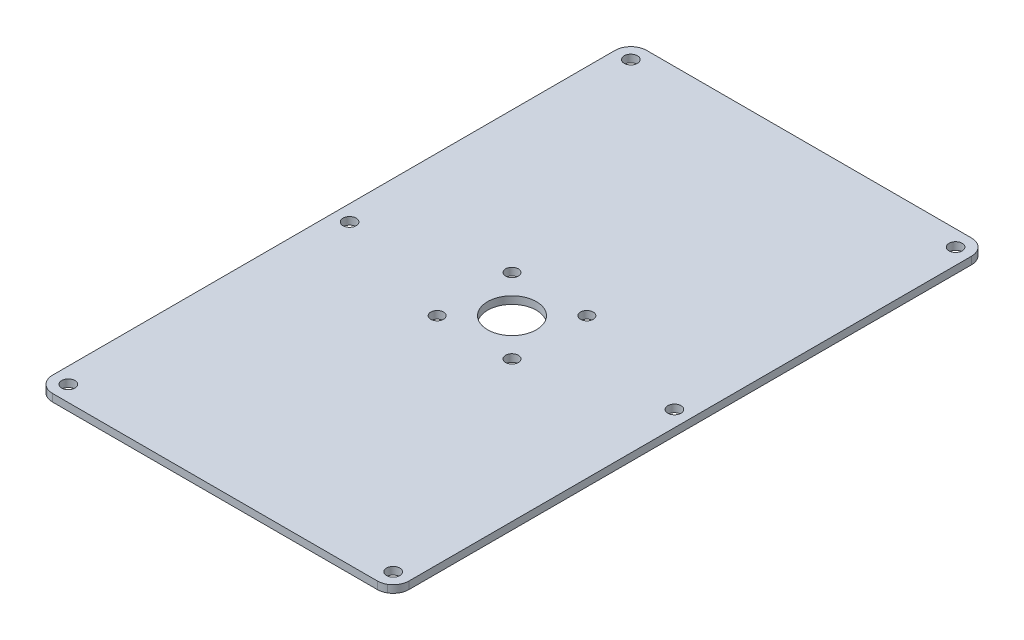
from build123d import *

# Parameters (mm, degrees)
SKETCH1_W            = 142.875
SKETCH1_H            = 238.125
BOSS_EXTRUDE1_DEPTH  = 3
CUT_EXTRUDE1_START   = -3
CUT_EXTRUDE1_DEPTH   = 3
M5_CLEARANCE_HOLE1_D = 5.3
SKETCH5_R            = 9.779
SKETCH5_R_2          = 2.55
CUT_EXTRUDE2_DEPTH   = 139.881947396
FILLET1_R            = 6.35


# Read off the part's stored shape, not the designer's step: Cut-Extrude1
with BuildPart() as part:
    # Sketch1 → Boss-Extrude1 (new body)
    with BuildSketch(Plane(origin=(0, 0, 0), x_dir=(1, 0, 0), z_dir=(0, 1, 0))):
        Rectangle(SKETCH1_W, SKETCH1_H)
    extrude(amount=BOSS_EXTRUDE1_DEPTH)

    # Cut-Extrude1 outline → Cut-Extrude1 (cut)
    with BuildSketch(Plane(origin=(0, 3, 0), x_dir=(1, 0, 0), z_dir=(0, 1, 0)).offset(CUT_EXTRUDE1_START)):
        with BuildLine():
            ThreePointArc((71.4375, -116.313944107), (69.11044358, -117.711497264), (66.756056607, -119.0625))
            Line((66.756056607, -119.0625), (71.4375, -119.0625))
            Line((71.4375, -119.0625), (71.4375, -116.313944107))
        make_face()
        with BuildLine():
            Line((-71.4375, -119.0625), (-66.756056607, -119.0625))
            ThreePointArc((-66.756056607, -119.0625), (-69.11044358, -117.711497264), (-71.4375, -116.313944107))
            Line((-71.4375, -116.313944107), (-71.4375, -119.0625))
        make_face()
        with BuildLine():
            ThreePointArc((66.756056607, 119.0625), (69.11044358, 117.711497264), (71.4375, 116.313944107))
            Line((71.4375, 116.313944107), (71.4375, 119.0625))
            Line((71.4375, 119.0625), (66.756056607, 119.0625))
        make_face()
        with BuildLine():
            Line((-71.4375, 119.0625), (-71.4375, 116.313944107))
            ThreePointArc((-71.4375, 116.313944107), (-69.11044358, 117.711497264), (-66.756056607, 119.0625))
            Line((-66.756056607, 119.0625), (-71.4375, 119.0625))
        make_face()
    extrude(amount=CUT_EXTRUDE1_DEPTH, mode=Mode.SUBTRACT)

    # M5 Clearance Hole1 (through all)
    with Locations(Plane(origin=(0, 3, 0), x_dir=(1, 0, 0), z_dir=(0, 1, 0))):
        with Locations((65.0875, 0), (-65.0875, 112.7125), (65.0875, 112.7125), (65.0875, -112.7125), (-65.0875, -112.7125), (-65.0875, 0)):
            Hole(M5_CLEARANCE_HOLE1_D / 2)

    # Sketch5 → Cut-Extrude2 (cut, through all)
    with BuildSketch(Plane(origin=(0, 3, 0), x_dir=(1, 0, 0), z_dir=(0, 1, 0))):
        with Locations(Location((0, 0, 0), (0, 0, 270))):
            Circle(SKETCH5_R)
        with Locations(Location((-15, 15, 0), (0, 0, 270))):
            Circle(SKETCH5_R_2)
        with Locations(Location((15, 15, 0), (0, 0, 270))):
            Circle(SKETCH5_R_2)
        with Locations(Location((15, -15, 0), (0, 0, 270))):
            Circle(SKETCH5_R_2)
        with Locations(Location((-15, -15, 0), (0, 0, 270))):
            Circle(SKETCH5_R_2)
    extrude(amount=-CUT_EXTRUDE2_DEPTH, mode=Mode.SUBTRACT)

    # Fillet1
    fillet1_edges = [part.edges().sort_by_distance(p)[0] for p in [
        (71.4375, 1.5, 116.313944107),
        (71.4375, 1.5, -116.313944107),
        (66.756056607, 1.5, -119.0625),
        (-66.756056607, 1.5, -119.0625),
        (-71.4375, 1.5, -116.313944107),
        (-71.4375, 1.5, 116.313944107),
        (-66.756056607, 1.5, 119.0625),
        (66.756056607, 1.5, 119.0625),
    ]]
    fillet(fillet1_edges, radius=FILLET1_R)


solid = part.part
